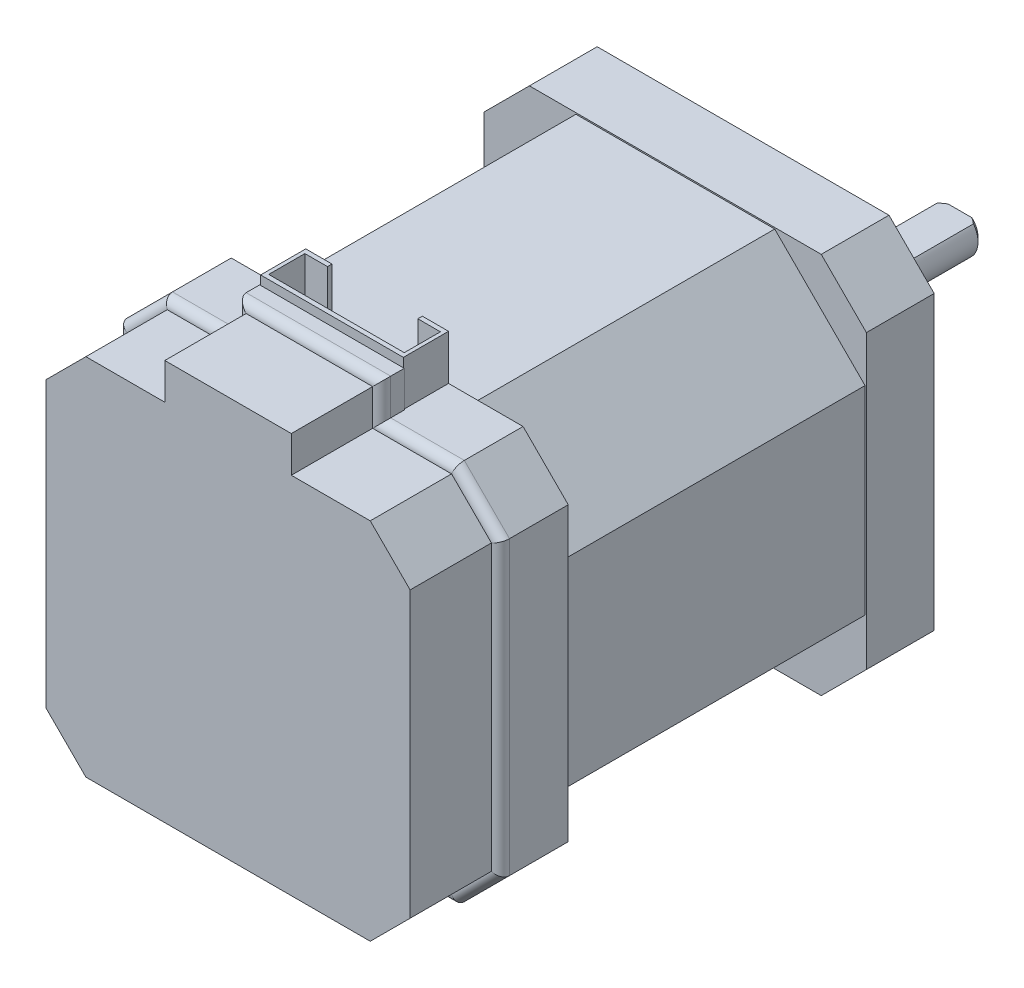
from build123d import *

# Parameters (mm, degrees)
SKETCH_1_W          = 42
SKETCH_1_H          = 42
EXTRUDE_1_DEPTH     = 33
CHAMFER_1_SIZE      = 10
SKETCH_2_W          = 42.3
SKETCH_2_H          = 42.3
EXTRUDE_2_DEPTH     = 7.5
SKETCH_3_W          = 42.3
SKETCH_3_H          = 42.3
EXTRUDE_3_DEPTH     = 7.5
CHAMFER_2_SIZE      = 5
SKETCH_4_R          = 1.5
CUT_EXTRUDE_1_DEPTH = 4.5
SKETCH_5_R          = 11
SKETCH_5_R_2        = 3.75
EXTRUDE_4_DEPTH     = 2
SKETCH_6_R          = 2.5
EXTRUDE_5_DEPTH     = 24
CUT_EXTRUDE_START   = -19
CUT_EXTRUDE_2_DEPTH = 19
CHAMFER_3_SIZE      = 0.5
EXTRUDE_6_DEPTH     = 2.5
FILLET_1_R          = 1
EXTRUDE_7_DEPTH     = 5
EXTRUDE_8_DEPTH     = 9
CHAMFER_4_SIZE      = 2.5


with BuildPart() as part:
    # 草图1 → 凸台-拉伸1 (new body)
    with BuildSketch(Plane.XY):
        Rectangle(SKETCH_1_W, SKETCH_1_H)
    extrude(amount=EXTRUDE_1_DEPTH)

    # 倒角1
    chamfer_1_edges = [part.edges().sort_by_distance(p)[0] for p in [
        (21, -21, 16.5),
        (-21, -21, 16.5),
        (-21, 21, 16.5),
        (21, 21, 16.5),
    ]]
    chamfer(chamfer_1_edges, length=CHAMFER_1_SIZE)

    # 草图2 → 凸台-拉伸2 (add)
    with BuildSketch(Plane.XY.offset(33)):
        Rectangle(SKETCH_2_W, SKETCH_2_H)
    extrude(amount=EXTRUDE_2_DEPTH)

    # 草图3 → 凸台-拉伸3 (add)
    with BuildSketch(Plane(origin=(0, 0, 0), x_dir=(-1, 0, 0), z_dir=(0, 0, -1))):
        Rectangle(SKETCH_3_W, SKETCH_3_H)
    extrude(amount=EXTRUDE_3_DEPTH)

    # 倒角2
    chamfer_2_edges = [part.edges().sort_by_distance(p)[0] for p in [
        (21.15, -21.15, 36.75),
        (21.15, 21.15, 36.75),
        (-21.15, 21.15, 36.75),
        (-21.15, -21.15, 36.75),
        (-21.15, -21.15, -3.75),
        (-21.15, 21.15, -3.75),
        (21.15, 21.15, -3.75),
        (21.15, -21.15, -3.75),
    ]]
    chamfer(chamfer_2_edges, length=CHAMFER_2_SIZE)

    # 草图4 → 切除-拉伸1 (cut)
    with BuildSketch(Plane(origin=(0, 0, -7.5), x_dir=(-1, 0, 0), z_dir=(0, 0, -1))):
        with Locations((-15.5, 15.5)):
            Circle(SKETCH_4_R)
        with Locations((15.5, 15.5)):
            Circle(SKETCH_4_R)
        with Locations((15.5, -15.5)):
            Circle(SKETCH_4_R)
        with Locations((-15.5, -15.5)):
            Circle(SKETCH_4_R)
    extrude(amount=-CUT_EXTRUDE_1_DEPTH, mode=Mode.SUBTRACT)

    # 草图5 → 凸台-拉伸4 (add)
    with BuildSketch(Plane(origin=(0, 0, -7.5), x_dir=(-1, 0, 0), z_dir=(0, 0, -1))):
        Circle(SKETCH_5_R)
        Circle(SKETCH_5_R_2, mode=Mode.SUBTRACT)
    extrude(amount=EXTRUDE_4_DEPTH)

    # 草图6 → 凸台-拉伸5 (add)
    with BuildSketch(Plane(origin=(0, 0, -7.5), x_dir=(-1, 0, 0), z_dir=(0, 0, -1))):
        Circle(SKETCH_6_R)
    extrude(amount=EXTRUDE_5_DEPTH)

    # 草图7 → 切除-拉伸2 (cut)
    with BuildSketch(Plane(origin=(0, 0, -31.5), x_dir=(-1, 0, 0), z_dir=(0, 0, -1)).offset(CUT_EXTRUDE_START)):
        with BuildLine():
            Line((2, 1.5), (-2, 1.5))
            ThreePointArc((-2, 1.5), (0, 2.5), (2, 1.5))
        make_face()
    extrude(amount=CUT_EXTRUDE_2_DEPTH, mode=Mode.SUBTRACT)

    # 倒角3
    chamfer_3_edges = [part.edges().sort_by_distance(p)[0] for p in [
        (0.790569415, -2.371708245, -31.5),
    ]]
    chamfer(chamfer_3_edges, length=CHAMFER_3_SIZE)

    # 草图8 → 凸台-拉伸6 (add)
    with BuildSketch(Plane.XY.offset(40.5)):
        Polygon((0, 21.15), (-8, 21.15), (-8, 25.15), (8, 25.15), (8, 21.15), align=None)
    extrude(amount=-EXTRUDE_6_DEPTH)

    # 圆角1
    fillet_1_edges = [part.edges().sort_by_distance(p)[0] for p in [
        (-12.075, 21.15, 40.5),
        (8, 23.15, 40.5),
        (0, 25.15, 40.5),
        (-8, 23.15, 40.5),
        (0, -21.15, 40.5),
        (-21.15, 0, 40.5),
        (21.15, 0, 40.5),
        (12.075, 21.15, 40.5),
        (-18.65, 18.65, 40.5),
        (18.65, 18.65, 40.5),
        (18.65, -18.65, 40.5),
        (-18.65, -18.65, 40.5),
    ]]
    fillet(fillet_1_edges, radius=FILLET_1_R)

    # 草图9 → 凸台-拉伸7 (add)
    with BuildSketch(Plane(origin=(0, 21.15, 0), x_dir=(1, 0, 0), z_dir=(0, 1, 0))):
        Polygon((7.9, -33), (5, -33), (5, -33.5), (7.5, -33.5), (7.5, -37.5), (-7.5, -37.5), (-7.5, -33.5), (-5, -33.5), (-5, -33), (-7.9, -33), (-7.9, -38), (7.9, -38), align=None)
    extrude(amount=EXTRUDE_7_DEPTH)

    # 草图10 → 凸台-拉伸8 (add)
    with BuildSketch(Plane.XY.offset(40.5)):
        Polygon((-7, 20.15), (-15.735786438, 20.15), (-20.15, 15.735786438), (-20.15, -15.735786438), (-15.735786438, -20.15), (15.735786438, -20.15), (20.15, -15.735786438), (20.15, 15.735786438), (15.735786438, 20.15), (7, 20.15), (7, 24.15), (-7, 24.15), align=None)
    extrude(amount=EXTRUDE_8_DEPTH)

    # 倒角4
    # the kernel refuses this chamfer: 2.5 mm, written as the material it adds along each edge
    with BuildSketch(Plane(origin=(0, 0, -7.5), x_dir=(-1, 0, 0), z_dir=(0, -1, 0))) as chamfer_4_piece_1:
        Polygon((2.5 + CHAMFER_4_SIZE, 0), (2.5, CHAMFER_4_SIZE), (2.5, 0), align=None)
    revolve(axis=Axis((0, 0, -7.5), (0, 0, -1)))


solid = part.part
